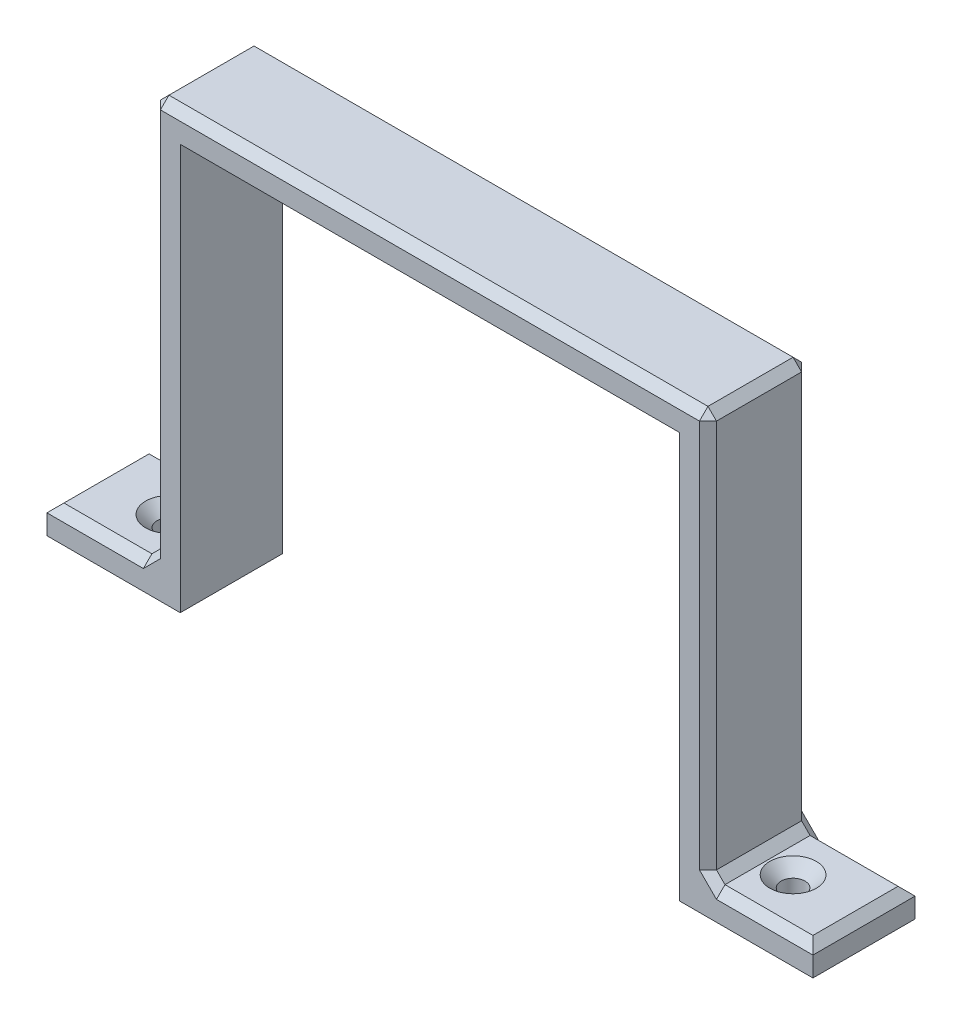
from build123d import *

# Parameters (mm, degrees)
BOSS_EXTRUDE1_DEPTH = 9
SKETCH2_R           = 2.1
CUT_EXTRUDE1_DEPTH  = 9
CHAMFER1_SIZE       = 2
CHAMFER2_SIZE       = 1.5


with BuildPart() as part:
    # Sketch1 → Boss-Extrude1 (new, symmetric)
    with BuildSketch(Plane.XY):
        Polygon((44, -27.85), (44, 43.65), (-44, 43.65), (-44, -27.85), (-67.5, -27.85), (-67.5, -22.85), (-49, -22.85), (-49, 48.65), (49, 48.65), (49, -22.85), (67.5, -22.85), (67.5, -27.85), align=None)
    extrude(amount=BOSS_EXTRUDE1_DEPTH, both=True)

    # Sketch2 → Cut-Extrude1 (cut, symmetric)
    with BuildSketch(Plane.XZ.offset(27.85)):
        with Locations((55, 0)):
            Circle(SKETCH2_R)
        with Locations((-55, 0)):
            Circle(SKETCH2_R)
    extrude(amount=CUT_EXTRUDE1_DEPTH, both=True, mode=Mode.SUBTRACT)

    # Chamfer1
    chamfer1_edges = [part.edges().sort_by_distance(p)[0] for p in [
        (-57.1, -22.85, 0),
        (52.9, -22.85, 0),
    ]]
    chamfer(chamfer1_edges, length=CHAMFER1_SIZE)

    # Chamfer2
    chamfer2_edges = [part.edges().sort_by_distance(p)[0] for p in [
        (49, 48.65, 0),
        (0, 48.65, 9),
        (-49, 48.65, 0),
        (0, 48.65, -9),
        (-49, 12.9, 9),
        (-49, 12.9, -9),
        (-49, -22.85, 0),
        (-58.25, -22.85, 9),
        (-67.5, -22.85, 0),
        (-58.25, -22.85, -9),
        (49, 12.9, 9),
        (49, 12.9, -9),
        (67.5, -22.85, 0),
        (58.25, -22.85, 9),
        (49, -22.85, 0),
        (58.25, -22.85, -9),
    ]]
    chamfer(chamfer2_edges, length=CHAMFER2_SIZE)


solid = part.part
